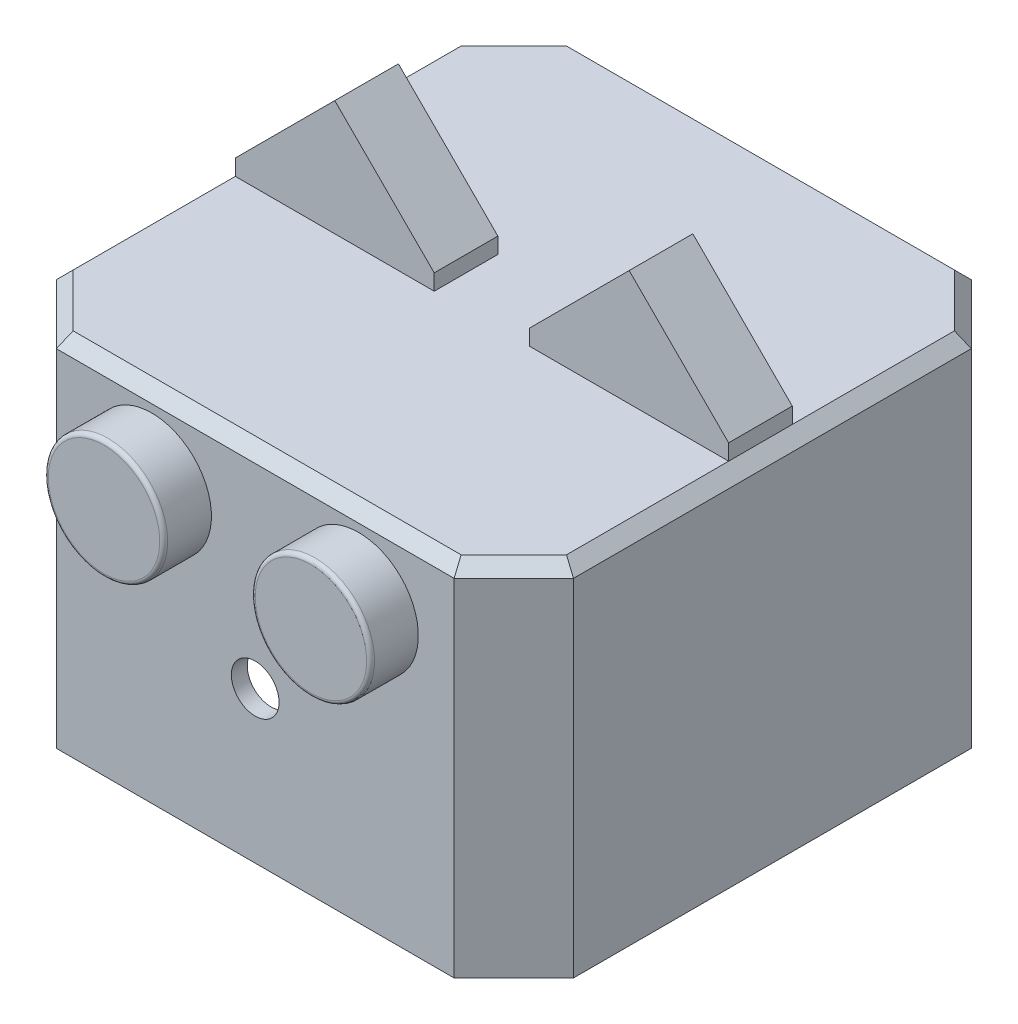
from build123d import *

# Parameters (mm, degrees)
SALIENTE_EXTRUIR1_DEPTH = 45
VACIADO2_T              = -2
CHAFL_N3_SIZE           = 1.5
CROQUIS2_R              = 7.5
SALIENTE_EXTRUIR2_DEPTH = 6
CROQUIS4_R              = 5
CORTAR_EXTRUIR2_DEPTH   = 5
REDONDEO1_R             = 0.5
CROQUIS5_R              = 3
CORTAR_EXTRUIR3_DEPTH   = 10
CROQUIS6_W              = 6
CROQUIS6_H              = 6
CORTAR_EXTRUIR4_DEPTH   = 10
SALIENTE_EXTRUIR8_START = 5
CROQUIS13_R             = 5
CROQUIS13_R_2           = 2.6
SALIENTE_EXTRUIR8_DEPTH = 5
CROQUIS7_W              = 4
CROQUIS7_H              = 4
SALIENTE_EXTRUIR3_DEPTH = 1
CROQUIS8_R              = 2
SALIENTE_EXTRUIR4_DEPTH = 1
CROQUIS9_R              = 1.6
CORTAR_EXTRUIR5_DEPTH   = 2
CROQUIS10_W             = 25
CROQUIS10_H             = 8
SALIENTE_EXTRUIR5_DEPTH = 2
SALIENTE_EXTRUIR6_DEPTH = 8
CROQUIS12_R             = 1.15
CROQUIS12_R_2           = 0.8
SALIENTE_EXTRUIR7_DEPTH = 6
CROQUIS14_W             = 3
CROQUIS14_H             = 2.5
SALIENTE_EXTRUIR9_DEPTH = 5
CROQUIS15_W             = 12
CROQUIS15_H             = 8
CORTAR_EXTRUIR6_DEPTH   = 2


with BuildPart() as part:
    # Croquis1 → Saliente-Extruir1 (new body)
    with BuildSketch(Plane(origin=(0, 0, 0), x_dir=(1, 0, 0), z_dir=(0, 1, 0))):
        Polygon((-25, -32.5), (25, -32.5), (32.5, -25), (32.5, 25), (25, 32.5), (-25, 32.5), (-32.5, 25), (-32.5, -25), align=None)
    extrude(amount=SALIENTE_EXTRUIR1_DEPTH)

    # Vaciado2
    vaciado2_openings = [part.faces().sort_by_distance(p)[0] for p in [
        (0, 0, 0),
    ]]
    offset(amount=VACIADO2_T, openings=vaciado2_openings, kind=Kind.INTERSECTION)

    # Chaflán3
    chafl_n3_edges = [part.edges().sort_by_distance(p)[0] for p in [
        (0, 45, -32.5),
        (32.5, 45, 0),
        (0, 45, 32.5),
        (-32.5, 45, 0),
        (-28.75, 45, 28.75),
        (28.75, 45, 28.75),
        (28.75, 45, -28.75),
        (-28.75, 45, -28.75),
    ]]
    chamfer(chafl_n3_edges, length=CHAFL_N3_SIZE)

    # Croquis2 → Saliente-Extruir2 (add)
    with BuildSketch(Plane.XY.offset(32.5)):
        with Locations((13, 35)):
            Circle(CROQUIS2_R)
        with Locations((-13, 35)):
            Circle(CROQUIS2_R)
    extrude(amount=SALIENTE_EXTRUIR2_DEPTH)

    # Croquis4 → Cortar-Extruir2 (cut)
    with BuildSketch(Plane(origin=(0, 0, 30.5), x_dir=(-1, 0, 0), z_dir=(0, 0, -1))):
        with Locations((-13, 35)):
            Circle(CROQUIS4_R)
        with Locations((13, 35)):
            Circle(CROQUIS4_R)
    extrude(amount=-CORTAR_EXTRUIR2_DEPTH, mode=Mode.SUBTRACT)

    # Redondeo1
    redondeo1_edges = [part.edges().sort_by_distance(p)[0] for p in [
        (-20.5, 35, 38.5),
        (5.5, 35, 38.5),
    ]]
    fillet(redondeo1_edges, radius=REDONDEO1_R)

    # Croquis5 → Cortar-Extruir3 (cut)
    with BuildSketch(Plane.XY.offset(32.5)):
        with Locations((0, 19)):
            Circle(CROQUIS5_R)
    extrude(amount=-CORTAR_EXTRUIR3_DEPTH, mode=Mode.SUBTRACT)

    # Croquis6 → Cortar-Extruir4 (cut)
    with BuildSketch(Plane(origin=(0, 0, -32.5), x_dir=(-1, 0, 0), z_dir=(0, 0, -1))):
        with Locations((-18, 6)):
            Rectangle(CROQUIS6_W, CROQUIS6_H)
    extrude(amount=-CORTAR_EXTRUIR4_DEPTH, mode=Mode.SUBTRACT)

    # Croquis13 → Saliente-Extruir8 (add)
    # profile 1 of 2: a face of its own
    with BuildSketch(Plane(origin=(0, 0, 35.5), x_dir=(-1, 0, 0), z_dir=(0, 0, -1)).offset(SALIENTE_EXTRUIR8_START)):
        with Locations((13, 35)):
            Circle(CROQUIS13_R)
        with Locations((13, 35)):
            Circle(CROQUIS13_R_2, mode=Mode.SUBTRACT)
    # profile 2 of 2: a face of its own
    with BuildSketch(Plane(origin=(0, 0, 35.5), x_dir=(-1, 0, 0), z_dir=(0, 0, -1)).offset(SALIENTE_EXTRUIR8_START)):
        with Locations((-13, 35)):
            Circle(CROQUIS13_R)
        with Locations((-13, 35)):
            Circle(CROQUIS13_R_2, mode=Mode.SUBTRACT)
    extrude(amount=-SALIENTE_EXTRUIR8_DEPTH)

    # Croquis7 → Saliente-Extruir3 (add)
    with BuildSketch(Plane(origin=(0, 0, 30.5), x_dir=(-1, 0, 0), z_dir=(0, 0, -1))):
        with Locations((-11.58, 10.5)):
            Rectangle(CROQUIS7_W, CROQUIS7_H)
        with Locations((-11.58, 28)):
            Rectangle(CROQUIS7_W, CROQUIS7_H)
        with Locations((11.43, 10.5)):
            Rectangle(CROQUIS7_W, CROQUIS7_H)
        with Locations((11.43, 28)):
            Rectangle(CROQUIS7_W, CROQUIS7_H)
    extrude(amount=SALIENTE_EXTRUIR3_DEPTH)

    # Croquis8 → Saliente-Extruir4 (add)
    with BuildSketch(Plane(origin=(0, 0, 29.5), x_dir=(-1, 0, 0), z_dir=(0, 0, -1))):
        with Locations((-11.505, 10.489346828)):
            Circle(CROQUIS8_R)
        with Locations((-11.505, 27.976317365)):
            Circle(CROQUIS8_R)
        with Locations((11.505, 10.489346828)):
            Circle(CROQUIS8_R)
        with Locations((11.505, 27.976317365)):
            Circle(CROQUIS8_R)
    extrude(amount=SALIENTE_EXTRUIR4_DEPTH)

    # Croquis9 → Cortar-Extruir5 (cut)
    with BuildSketch(Plane(origin=(0, 0, 28.5), x_dir=(-1, 0, 0), z_dir=(0, 0, -1))):
        with Locations((-11.505, 27.976317365)):
            Circle(CROQUIS9_R)
        with Locations((-11.505, 10.489346828)):
            Circle(CROQUIS9_R)
        with Locations((11.505, 10.489346828)):
            Circle(CROQUIS9_R)
        with Locations((11.505, 27.976317365)):
            Circle(CROQUIS9_R)
    extrude(amount=-CORTAR_EXTRUIR5_DEPTH, mode=Mode.SUBTRACT)

    # Croquis10 → Saliente-Extruir5 (add)
    with BuildSketch(Plane(origin=(0, 45, 0), x_dir=(1, 0, 0), z_dir=(0, 1, 0))):
        with Locations((-18.5, 0)):
            Rectangle(CROQUIS10_W, CROQUIS10_H)
        with Locations((18.5, 0)):
            Rectangle(CROQUIS10_W, CROQUIS10_H)
    extrude(amount=SALIENTE_EXTRUIR5_DEPTH)

    # Croquis11 → Saliente-Extruir6 (add)
    with BuildSketch(Plane.XY.offset(4)):
        Polygon((-31, 47), (-6, 47), (-18.5, 59.5), align=None)
        Polygon((31, 47), (18.5, 59.5), (6, 47), align=None)
    extrude(amount=-SALIENTE_EXTRUIR6_DEPTH)

    # Croquis12 → Saliente-Extruir7 (add)
    # profile 1 of 4: a face of its own
    with BuildSketch(Plane.XZ.offset(-43)):
        with Locations((-20.65, 7.68)):
            Circle(CROQUIS12_R)
        with Locations((-20.65, 7.68)):
            Circle(CROQUIS12_R_2, mode=Mode.SUBTRACT)
    # profile 2 of 4: a face of its own
    with BuildSketch(Plane.XZ.offset(-43)):
        with Locations((-20.65, -7.68)):
            Circle(CROQUIS12_R)
        with Locations((-20.65, -7.68)):
            Circle(CROQUIS12_R_2, mode=Mode.SUBTRACT)
    # profile 3 of 4: a face of its own
    with BuildSketch(Plane.XZ.offset(-43)):
        with Locations((20.65, 7.68)):
            Circle(CROQUIS12_R)
        with Locations((20.65, 7.68)):
            Circle(CROQUIS12_R_2, mode=Mode.SUBTRACT)
    # profile 4 of 4: a face of its own
    with BuildSketch(Plane.XZ.offset(-43)):
        with Locations((20.65, -7.68)):
            Circle(CROQUIS12_R)
        with Locations((20.65, -7.68)):
            Circle(CROQUIS12_R_2, mode=Mode.SUBTRACT)
    extrude(amount=SALIENTE_EXTRUIR7_DEPTH)

    # Croquis14 → Saliente-Extruir9 (add)
    with BuildSketch(Plane.XZ.offset(-43)):
        with Locations((-20.65, 7.68)):
            Rectangle(CROQUIS14_W, CROQUIS14_H)
        with Locations((-20.65, -7.68)):
            Rectangle(CROQUIS14_W, CROQUIS14_H)
        with Locations((20.65, 7.68)):
            Rectangle(CROQUIS14_W, CROQUIS14_H)
        with Locations((20.65, -7.68)):
            Rectangle(CROQUIS14_W, CROQUIS14_H)
    extrude(amount=SALIENTE_EXTRUIR9_DEPTH)

    # Croquis15 → Cortar-Extruir6 (cut)
    with BuildSketch(Plane.ZY.offset(32.5)):
        with Locations((0, 38.5)):
            Rectangle(CROQUIS15_W, CROQUIS15_H)
    extrude(amount=-CORTAR_EXTRUIR6_DEPTH, mode=Mode.SUBTRACT)


solid = part.part
